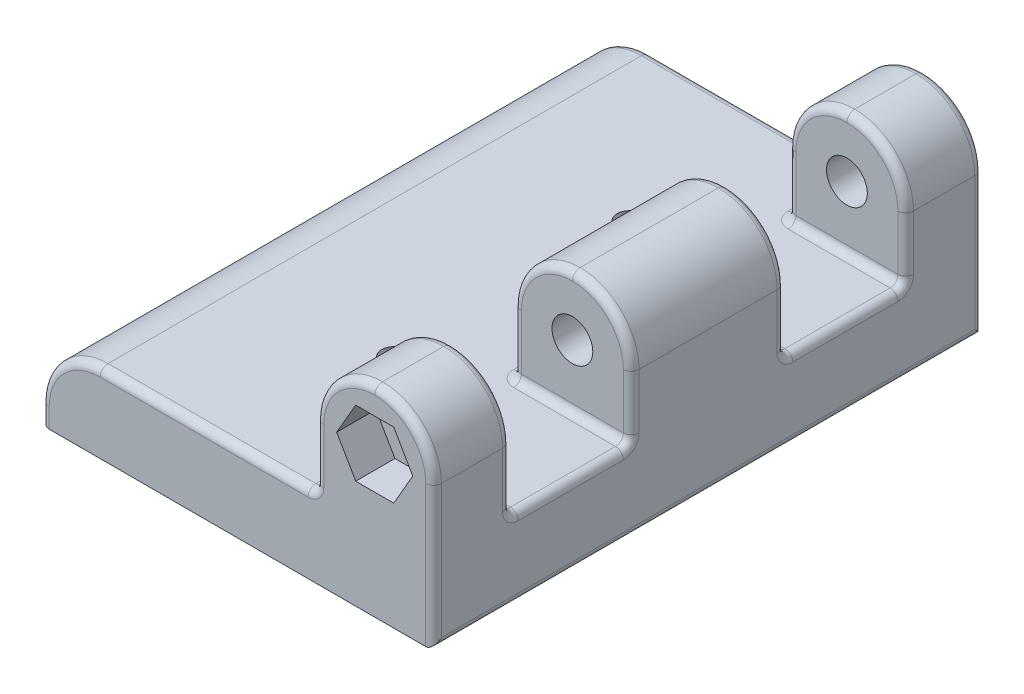
from build123d import *

# Parameters (mm, degrees)
SKETCH1_W           = 50
SKETCH1_H           = 70
BOSS_EXTRUDE1_DEPTH = 10
SKETCH4_W           = 15
SKETCH4_H           = 9.8
SKETCH4_H_2         = 19.6
BOSS_EXTRUDE2_DEPTH = 15.5
SKETCH5_R           = 2.6
CUT_EXTRUDE1_DEPTH  = 79.582758923
FILLET1_R           = 7.5
CUT_EXTRUDE2_DEPTH  = 5
SKETCH7_R           = 5.1
CUT_EXTRUDE3_DEPTH  = 5
FILLET2_R           = 7.5
SKETCH8_R           = 1.6
CUT_EXTRUDE4_DEPTH  = 5
FILLET3_R           = 1


with BuildPart() as part:
    # Sketch1 → Boss-Extrude1 (new body)
    with BuildSketch(Plane(origin=(0, 0, 0), x_dir=(1, 0, 0), z_dir=(0, 1, 0))):
        Rectangle(SKETCH1_W, SKETCH1_H)
    extrude(amount=BOSS_EXTRUDE1_DEPTH)

    # Sketch4 → Boss-Extrude2 (add)
    with BuildSketch(Plane(origin=(0, 10, 0), x_dir=(1, 0, 0), z_dir=(0, 1, 0))):
        with Locations((17.5, 30.1)):
            Rectangle(SKETCH4_W, SKETCH4_H)
        with Locations((17.5, -30.1)):
            Rectangle(SKETCH4_W, SKETCH4_H)
        with Locations((17.5, 0)):
            Rectangle(SKETCH4_W, SKETCH4_H_2)
    extrude(amount=BOSS_EXTRUDE2_DEPTH)

    # Sketch5 → Cut-Extrude1 (cut, through all)
    with BuildSketch(Plane.XY.offset(35)):
        with Locations((17.5, 18)):
            Circle(SKETCH5_R)
    extrude(amount=-CUT_EXTRUDE1_DEPTH, mode=Mode.SUBTRACT)

    # Fillet1
    fillet1_edges = [part.edges().sort_by_distance(p)[0] for p in [
        (10, 25.5, -30.1),
        (10, 25.5, 0),
        (10, 25.5, 30.1),
        (25, 25.5, 30.1),
        (25, 25.5, 0),
        (25, 25.5, -30.1),
    ]]
    fillet(fillet1_edges, radius=FILLET1_R - 0.0001)  # a hair under: the kernel refuses the full size

    # Sketch6 → Cut-Extrude2 (cut)
    with BuildSketch(Plane.XY.offset(35)):
        Polygon((19.924871131, 13.8), (22.349742261, 18), (19.924871131, 22.2), (15.075128869, 22.2), (12.650257739, 18), (15.075128869, 13.8), align=None)
    extrude(amount=-CUT_EXTRUDE2_DEPTH, mode=Mode.SUBTRACT)

    # Sketch7 → Cut-Extrude3 (cut)
    with BuildSketch(Plane(origin=(0, 0, -35), x_dir=(-1, 0, 0), z_dir=(0, 0, -1))):
        with Locations((-17.5, 18)):
            Circle(SKETCH7_R)
    extrude(amount=-CUT_EXTRUDE3_DEPTH, mode=Mode.SUBTRACT)

    # Fillet2
    fillet2_edges = [part.edges().sort_by_distance(p)[0] for p in [
        (-25, 10, 0),
    ]]
    fillet(fillet2_edges, radius=FILLET2_R)

    # Sketch8 → Cut-Extrude4 (cut)
    with BuildSketch(Plane(origin=(0, 10, 0), x_dir=(1, 0, 0), z_dir=(0, 1, 0))):
        with Locations(Location((0, 15, 0), (0, 0, 270))):
            Circle(SKETCH8_R)
        with Locations(Location((0, -15, 0), (0, 0, 270))):
            Circle(SKETCH8_R)
    extrude(amount=-CUT_EXTRUDE4_DEPTH, mode=Mode.SUBTRACT)

    # Fillet3
    fillet3_edges = [part.edges().sort_by_distance(p)[0] for p in [
        (-3.75, 10, -35),
        (-3.75, 10, 35),
        (-25, 1.25, 35),
        (-22.803300859, 7.803300859, 35),
        (-25, 1.25, -35),
        (-22.803300859, 7.803300859, -35),
        (10, 10, -30.1),
        (17.5, 10, -25.2),
        (25, 10, 17.5),
        (17.5, 10, 25.2),
        (10, 10, 30.1),
        (25, 10, -17.5),
        (17.5, 10, -9.8),
        (10, 10, 0),
        (17.5, 10, 9.8),
        (25, 0, 0),
        (25, 14.00005, -25.2),
        (10, 14.00005, -25.2),
        (22.803330148, 23.303330148, -25.2),
        (12.196669852, 23.303330148, -25.2),
        (10, 14.00005, -35),
        (25, 9.00005, -35),
        (22.803330148, 23.303330148, -35),
        (12.196669852, 23.303330148, -35),
        (25, 14.00005, 9.8),
        (10, 14.00005, 9.8),
        (22.803330148, 23.303330148, 9.8),
        (12.196669852, 23.303330148, 9.8),
        (10, 14.00005, -9.8),
        (25, 14.00005, -9.8),
        (22.803330148, 23.303330148, -9.8),
        (12.196669852, 23.303330148, -9.8),
        (25, 9.00005, 35),
        (10, 14.00005, 35),
        (22.803330148, 23.303330148, 35),
        (12.196669852, 23.303330148, 35),
        (10, 14.00005, 25.2),
        (25, 14.00005, 25.2),
        (22.803330148, 23.303330148, 25.2),
        (12.196669852, 23.303330148, 25.2),
    ]]
    fillet(fillet3_edges, radius=FILLET3_R)


solid = part.part
